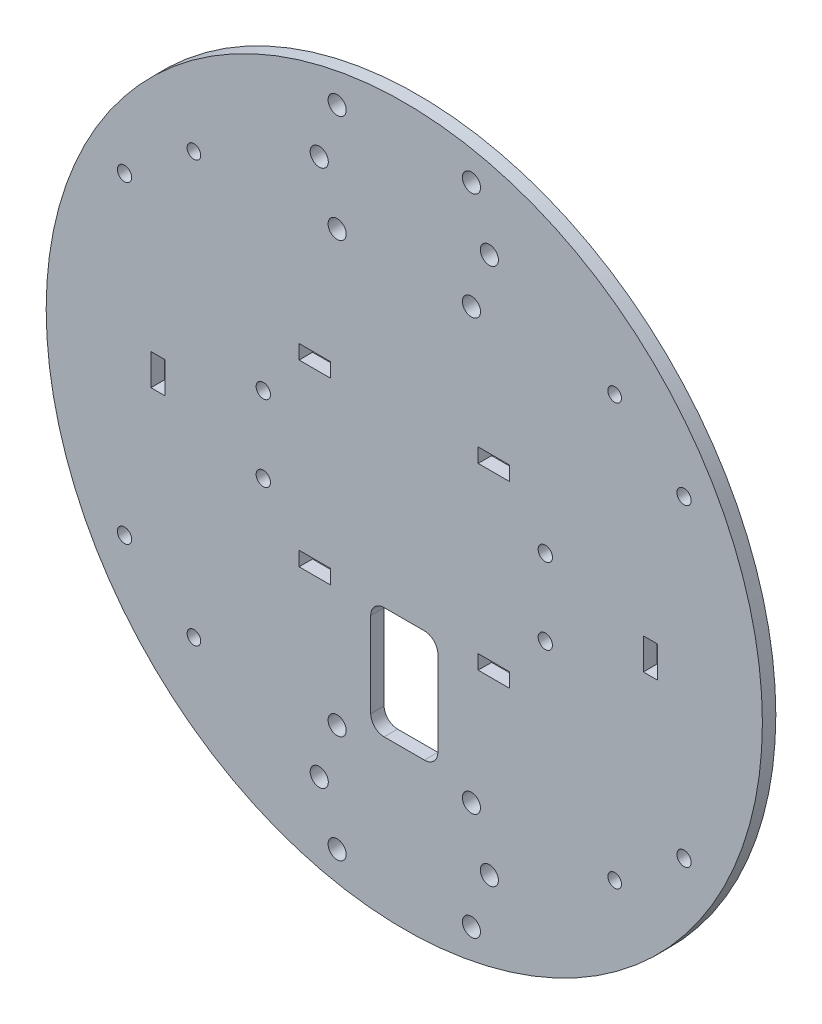
from build123d import *

# Parameters (mm, degrees)
SKETCH_1_R      = 80
SKETCH_1_R_2    = 1.52
SKETCH_1_R_3    = 2.025
SKETCH_1_R_4    = 1.6
SKETCH_1_W      = 15
SKETCH_1_H      = 25
EXTRUDE_1_DEPTH = 3
SKETCH_1103_W   = 7
SKETCH_1103_H   = 3.2
SKETCH_1103_W_2 = 3.2
SKETCH_1103_H_2 = 7
BB_DEPTH        = 3
FILLET_1_R      = 3


with BuildPart() as part:
    # 草图1 → 凸台-拉伸1 (new body)
    with BuildSketch(Plane.XY):
        Circle(SKETCH_1_R)
        with Locations((-47, 47)):
            Circle(SKETCH_1_R_2, mode=Mode.SUBTRACT)
        with Locations((47, 47)):
            Circle(SKETCH_1_R_2, mode=Mode.SUBTRACT)
        with Locations((47, -47)):
            Circle(SKETCH_1_R_2, mode=Mode.SUBTRACT)
        with Locations((-47, -47)):
            Circle(SKETCH_1_R_2, mode=Mode.SUBTRACT)
        with Locations((19, 60)):
            Circle(SKETCH_1_R_3, mode=Mode.SUBTRACT)
        with Locations((15, 72)):
            Circle(SKETCH_1_R_3, mode=Mode.SUBTRACT)
        with Locations((15, 48)):
            Circle(SKETCH_1_R_3, mode=Mode.SUBTRACT)
        with Locations((-15, 48)):
            Circle(SKETCH_1_R_3, mode=Mode.SUBTRACT)
        with Locations((-19, 60)):
            Circle(SKETCH_1_R_3, mode=Mode.SUBTRACT)
        with Locations((-15, 72)):
            Circle(SKETCH_1_R_3, mode=Mode.SUBTRACT)
        with Locations((15, -48)):
            Circle(SKETCH_1_R_3, mode=Mode.SUBTRACT)
        with Locations((15, -72)):
            Circle(SKETCH_1_R_3, mode=Mode.SUBTRACT)
        with Locations((19, -60)):
            Circle(SKETCH_1_R_3, mode=Mode.SUBTRACT)
        with Locations((-15, -48)):
            Circle(SKETCH_1_R_3, mode=Mode.SUBTRACT)
        with Locations((-19, -60)):
            Circle(SKETCH_1_R_3, mode=Mode.SUBTRACT)
        with Locations((-15, -72)):
            Circle(SKETCH_1_R_3, mode=Mode.SUBTRACT)
        with Locations((-62.5, 35)):
            Circle(SKETCH_1_R_4, mode=Mode.SUBTRACT)
        with Locations((-62.5, -35)):
            Circle(SKETCH_1_R_4, mode=Mode.SUBTRACT)
        with Locations((-31.5, 8.5)):
            Circle(SKETCH_1_R_4, mode=Mode.SUBTRACT)
        with Locations((-31.5, -8.5)):
            Circle(SKETCH_1_R_4, mode=Mode.SUBTRACT)
        with Locations((31.5, -8.5)):
            Circle(SKETCH_1_R_4, mode=Mode.SUBTRACT)
        with Locations((31.5, 8.5)):
            Circle(SKETCH_1_R_4, mode=Mode.SUBTRACT)
        with Locations((62.5, 35)):
            Circle(SKETCH_1_R_4, mode=Mode.SUBTRACT)
        with Locations((62.5, -35)):
            Circle(SKETCH_1_R_4, mode=Mode.SUBTRACT)
        with Locations((0, -32.5)):
            Rectangle(SKETCH_1_W, SKETCH_1_H, mode=Mode.SUBTRACT)
    extrude(amount=EXTRUDE_1_DEPTH)

    # Sketch 1103 → 电池+BB响扎带孔位 (cut)
    with BuildSketch(Plane.XY):
        with Locations((20, -20)):
            Rectangle(SKETCH_1103_W, SKETCH_1103_H)
        with Locations((20, 20)):
            Rectangle(SKETCH_1103_W, SKETCH_1103_H)
        with Locations((55, 0)):
            Rectangle(SKETCH_1103_W_2, SKETCH_1103_H_2)
        with Locations((-20, 20)):
            Rectangle(SKETCH_1103_W, SKETCH_1103_H)
        with Locations((-55, 0)):
            Rectangle(SKETCH_1103_W_2, SKETCH_1103_H_2)
        with Locations((-20, -20)):
            Rectangle(SKETCH_1103_W, SKETCH_1103_H)
    extrude(amount=BB_DEPTH, mode=Mode.SUBTRACT)

    # 圆角1
    fillet_1_edges = [part.edges().sort_by_distance(p)[0] for p in [
        (-7.5, -45, 1.5),
        (7.5, -45, 1.5),
        (-7.5, -20, 1.5),
        (7.5, -20, 1.5),
    ]]
    fillet(fillet_1_edges, radius=FILLET_1_R)


solid = part.part
